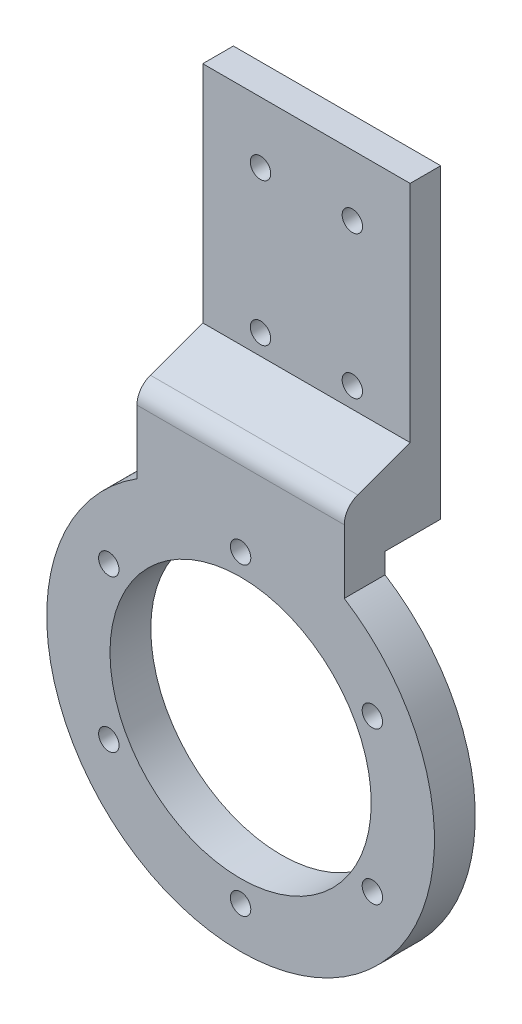
from build123d import *

# Parameters (mm, degrees)
SKETCH1_W           = 50.8
SKETCH1_H           = 65.000000038
SKETCH1_R           = 2.5
EXTRUDE_5_DEPTH     = 7.5
SKETCH1_3_W         = 50.8
SKETCH1_3_H         = 10
BOSS_EXTRUDE1_DEPTH = 13.63
BOSS_EXTRUDE2_START = 13.63
SKETCH1_4_R         = 2.5
SKETCH1_4_R_2       = 32
SKETCH1_4_W         = 50.8
SKETCH1_4_H         = 10
BOSS_EXTRUDE2_DEPTH = 10
CHAMFER1_SIZE       = 10
CHAMFER1_SIZE_2     = 27.474774195
FILLET1_R           = 5


with BuildPart() as part:
    # Sketch1 → 5 (new body)
    with BuildSketch(Plane.XY):
        with Locations((0, 87.638385637)):
            Rectangle(SKETCH1_W, SKETCH1_H)
        with Locations((-11.25, 70.138385656)):
            Circle(SKETCH1_R, mode=Mode.SUBTRACT)
        with Locations((-11.25, 105.138385656)):
            Circle(SKETCH1_R, mode=Mode.SUBTRACT)
        with Locations((11.25, 70.138385656)):
            Circle(SKETCH1_R, mode=Mode.SUBTRACT)
        with Locations((11.25, 105.138385656)):
            Circle(SKETCH1_R, mode=Mode.SUBTRACT)
    extrude(amount=EXTRUDE_5_DEPTH)

    # Sketch1<3> → Boss-Extrude1 (add)
    with BuildSketch(Plane.XY):
        with Locations((0, 50.138385618)):
            Rectangle(SKETCH1_3_W, SKETCH1_3_H)
    extrude(amount=BOSS_EXTRUDE1_DEPTH)

    # Sketch1<4> → Boss-Extrude2 (add)
    # profile 1 of 2: a face of its own
    with BuildSketch(Plane.XY.offset(BOSS_EXTRUDE2_START)):
        with BuildLine():
            Line((-25.4, 45.138385618), (-25.4, 40.138385618))
            ThreePointArc((-25.4, 40.138385618), (0, -47.5), (25.4, 40.138385618))
            Line((25.4, 40.138385618), (25.4, 45.138385618))
            Line((25.4, 45.138385618), (-25.4, 45.138385618))
        make_face()
        with Locations((-32.285427053, -18.64)):
            Circle(SKETCH1_4_R, mode=Mode.SUBTRACT)
        with Locations((-32.285427053, 18.64)):
            Circle(SKETCH1_4_R, mode=Mode.SUBTRACT)
        with Locations((0, -37.28)):
            Circle(SKETCH1_4_R, mode=Mode.SUBTRACT)
        with Locations((32.285427053, -18.64)):
            Circle(SKETCH1_4_R, mode=Mode.SUBTRACT)
        Circle(SKETCH1_4_R_2, mode=Mode.SUBTRACT)
        with Locations((32.285427053, 18.64)):
            Circle(SKETCH1_4_R, mode=Mode.SUBTRACT)
        with Locations((0, 37.28)):
            Circle(SKETCH1_4_R, mode=Mode.SUBTRACT)
    # profile 2 of 2: a face of its own
    with BuildSketch(Plane.XY.offset(BOSS_EXTRUDE2_START)):
        with Locations((0, 50.138385618)):
            Rectangle(SKETCH1_4_W, SKETCH1_4_H)
    extrude(amount=BOSS_EXTRUDE2_DEPTH)

    # Chamfer1
    # the kernel refuses this chamfer: 27.474774195, 10 mm, written as the material it adds along each edge
    with BuildSketch(Plane(origin=(-25.4, 55.138385618, 7.5), x_dir=(0, 0.9950833631817486, -0.0990409022520505), z_dir=(1, 0, 0))) as chamfer1_piece_1_section:
        Polygon((CHAMFER1_SIZE * 0.995083363182, CHAMFER1_SIZE * 0.0990409022521), (-CHAMFER1_SIZE_2 * 0.0990409022504, CHAMFER1_SIZE_2 * 0.995083363165), (0, 0), align=None)
    chamfer1_piece_1 = extrude(amount=50.8, mode=Mode.PRIVATE)
    chamfer1_piece_1 = split(chamfer1_piece_1, bisect_by=Plane(origin=(0, 58.754193251, 23.63), z_dir=(0, 0, -1)), keep=Keep.TOP, mode=Mode.PRIVATE)
    add(chamfer1_piece_1)

    # Fillet1
    fillet1_edges = [part.edges().sort_by_distance(p)[0] for p in [
        (0, 59.267545739, 23.63),
    ]]
    fillet(fillet1_edges, radius=FILLET1_R)


solid = part.part
